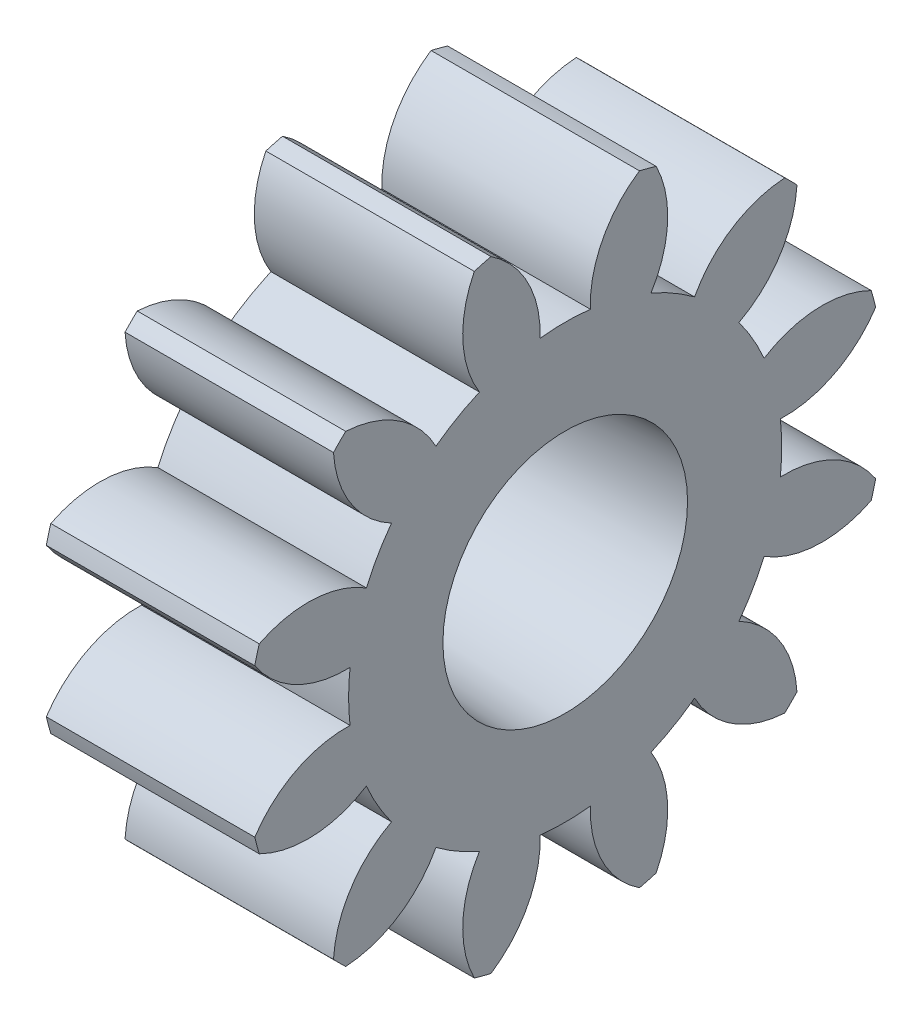
from build123d import *
from build123d.topology import SkipClean

# Parameters (mm, degrees)
BASPROSKE_W             = 8
BASPROSKE_H             = 12.25
TOOTHCUT_DEPTH          = 20.082059637
TEETHCUTS_COUNT         = 12
TEETHCUTS_ANGLE         = 330
HUBNEARONE_START        = 8.0000508
HUBNEAONESKE_R          = 8.3115
HUBNEARONE_DEPTH        = 8.0000508
BORSKE_R                = 4.5
BORE_DEPTH              = 16.0000508
ESQUISSE1_R             = 8.3115
ENL_V_MAT_EXTRU_1_DEPTH = 8
ESQUISSE2_R             = 4.5
ESQUISSE2_R_2           = 4.275
BOSS_EXTRU_1_DEPTH      = 8
ESQUISSE3_R             = 4.275
ENL_V_MAT_EXTRU_2_DEPTH = 10
ENL_V_MAT_EXTRU_2_DRAFT = 3


with BuildPart() as part:
    # BasProSke → Base-Revolve (revolve)
    with BuildSketch(Plane(origin=(0, 0, 0), x_dir=(1, 0, 0), z_dir=(0, 1, 0))):
        with Locations((4, 6.125)):
            Rectangle(BASPROSKE_W, BASPROSKE_H)
    revolve(axis=Axis((-10, 0, 0), (1, 0, 0)))

    # TooCutSke → ToothCut (cut, through all)
    with BuildSketch(Plane(origin=(0, 0, 0), x_dir=(0, 0, -1), z_dir=(1, 0, 0))):
        with BuildLine():
            ThreePointArc((0.965128363, 8.255274647), (0, 8.3115), (-0.965128363, 8.255274647))
            ThreePointArc((-0.965128363, 8.255274647), (-1.43628674, 10.346733197), (-2.878284339, 11.933185846))
            ThreePointArc((-2.878284339, 11.933185846), (0, 12.2754), (2.878284339, 11.933185846))
            ThreePointArc((2.878284339, 11.933185846), (1.43628674, 10.346733197), (0.965128363, 8.255274647))
        make_face()
    toothcut = extrude(amount=TOOTHCUT_DEPTH, mode=Mode.SUBTRACT)

    # TeethCuts: ToothCut ×12 about axis
    teethcuts_axis = Axis((-10, 0, 0), (1, 0, 0))
    for i in range(1, TEETHCUTS_COUNT):
        add(toothcut.rotate(teethcuts_axis, i * TEETHCUTS_ANGLE / (TEETHCUTS_COUNT - 1)), mode=Mode.SUBTRACT)

    # HubNeaOneSke → HubNearOne (add)
    with SkipClean():  # the faces are left unmerged after this step: merging them gives an invalid solid
        with BuildSketch(Plane.ZY.offset(HUBNEARONE_START)):
            Circle(HUBNEAONESKE_R)
        extrude(amount=-HUBNEARONE_DEPTH)

    # BorSke → Bore (cut, symmetric)
    with SkipClean():  # the faces are left unmerged after this step: merging them gives an invalid solid
        with BuildSketch(Plane(origin=(0, 0, 0), x_dir=(0, 0, -1), z_dir=(1, 0, 0))):
            Circle(BORSKE_R)
        extrude(amount=BORE_DEPTH, both=True, mode=Mode.SUBTRACT)

    # Esquisse1 → Enlèv. mat.-Extru.1 (cut)
    with SkipClean():  # the faces are left unmerged after this step: merging them gives an invalid solid
        with BuildSketch(Plane.ZY.offset(8.0000508)):
            Circle(ESQUISSE1_R)
        extrude(amount=-ENL_V_MAT_EXTRU_1_DEPTH, mode=Mode.SUBTRACT)

    # Esquisse2 → Boss.-Extru.1 (add)
    with SkipClean():  # the faces are left unmerged after this step: merging them gives an invalid solid
        with BuildSketch(Plane(origin=(8, 0, 0), x_dir=(0, 0, -1), z_dir=(1, 0, 0))):
            Circle(ESQUISSE2_R)
            Circle(ESQUISSE2_R_2, mode=Mode.SUBTRACT)
        extrude(amount=-BOSS_EXTRU_1_DEPTH)


with BuildPart() as enl_v_mat_extru_2_tool:
    # Esquisse3 → Enlèv. mat.-Extru.2 (with draft: the straight prism first)
    with BuildSketch(Plane.ZY.offset(5.08e-05)):
        Circle(ESQUISSE3_R)
    extrude(amount=-ENL_V_MAT_EXTRU_2_DEPTH)
    # Enlèv. mat.-Extru.2: the draft: its side faces are tilted about the plane it starts from
    enl_v_mat_extru_2_sides = [enl_v_mat_extru_2_tool.faces().sort_by_distance(p)[0] for p in [
        (4.9999492, 0, -4.275),
    ]]
    draft(enl_v_mat_extru_2_sides, Plane.ZY.offset(5.08e-05), ENL_V_MAT_EXTRU_2_DRAFT)


with BuildPart() as part_1:
    add(part.part)

    # Enlèv. mat.-Extru.2: cut by enl_v_mat_extru_2_tool
    add(enl_v_mat_extru_2_tool.part, mode=Mode.SUBTRACT)


solid = part_1.part
